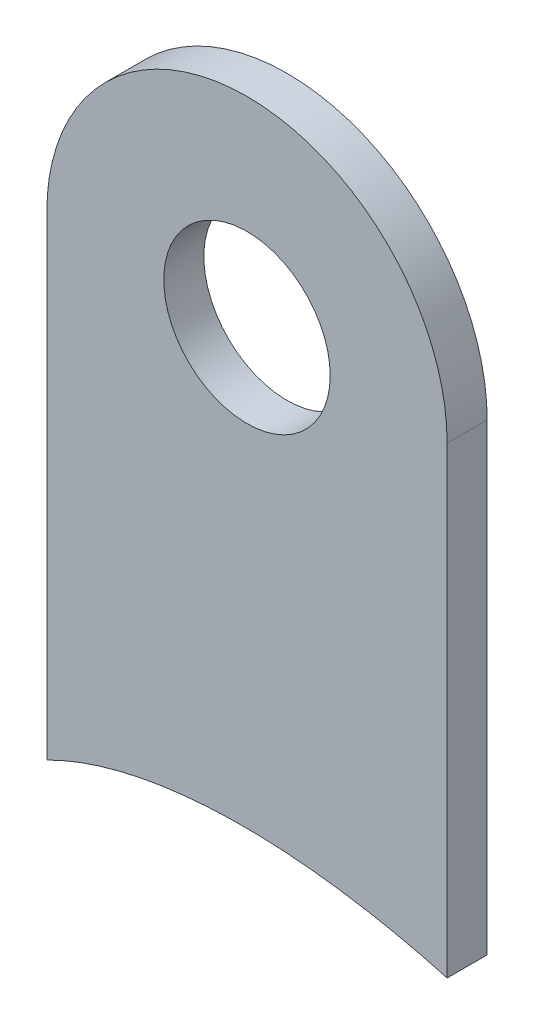
from build123d import *

# Parameters (mm, degrees)
BOSS_EXTRUDE1_DEPTH  = 1.5875
M6_CLEARANCE_HOLE1_D = 6.6
SKETCH5_W            = 15.875
SKETCH5_H            = 6.35
CUT_EXTRUDE2_DEPTH   = 27.658658303
CUT_EXTRUDE3_DEPTH   = 21.698467637


with BuildPart() as part:
    # Sketch1 → Boss-Extrude1 (new body)
    with BuildSketch(Plane.XY):
        with BuildLine():
            Line((7.9375, -25.4), (7.9375, 0))
            ThreePointArc((7.9375, 0), (0, 7.9375), (-7.9375, 0))
            Line((-7.9375, 0), (-7.9375, -25.4))
            Line((-7.9375, -25.4), (7.9375, -25.4))
        make_face()
    extrude(amount=BOSS_EXTRUDE1_DEPTH)

    # M6 Clearance Hole1 (through all)
    with Locations(Plane.XY.offset(1.5875)):
        with Locations((0, 0)):
            Hole(M6_CLEARANCE_HOLE1_D / 2)

    # Sketch5 → Cut-Extrude2 (cut, through all)
    with BuildSketch(Plane.XY.offset(1.5875)):
        with Locations((0, -22.225)):
            Rectangle(SKETCH5_W, SKETCH5_H)
    extrude(amount=-CUT_EXTRUDE2_DEPTH, mode=Mode.SUBTRACT)

    # Sketch6 → Cut-Extrude3 (cut, through all)
    with BuildSketch(Plane(origin=(0, 0, 0), x_dir=(-1, 0, 0), z_dir=(0, 0, -1))):
        with BuildLine():
            add(Edge.make_bspline(
                [(12.030285896, -22.899436183), (1.652467131, 0.283766307), (-38.284264846, -17.593667439), (-27.906446081, -40.776869929), (-17.528627316, -63.960072418), (22.408104661, -46.082638673), (12.030285896, -22.899436183)],
                knots=[0, 0, 0, 0, 0.5, 0.5, 0.5, 1, 1, 1, 1], degree=3, weights=[1, 0.333333333, 0.333333333, 1, 0.333333333, 0.333333333, 1]))
        make_face()
    extrude(amount=-CUT_EXTRUDE3_DEPTH, mode=Mode.SUBTRACT)


solid = part.part
